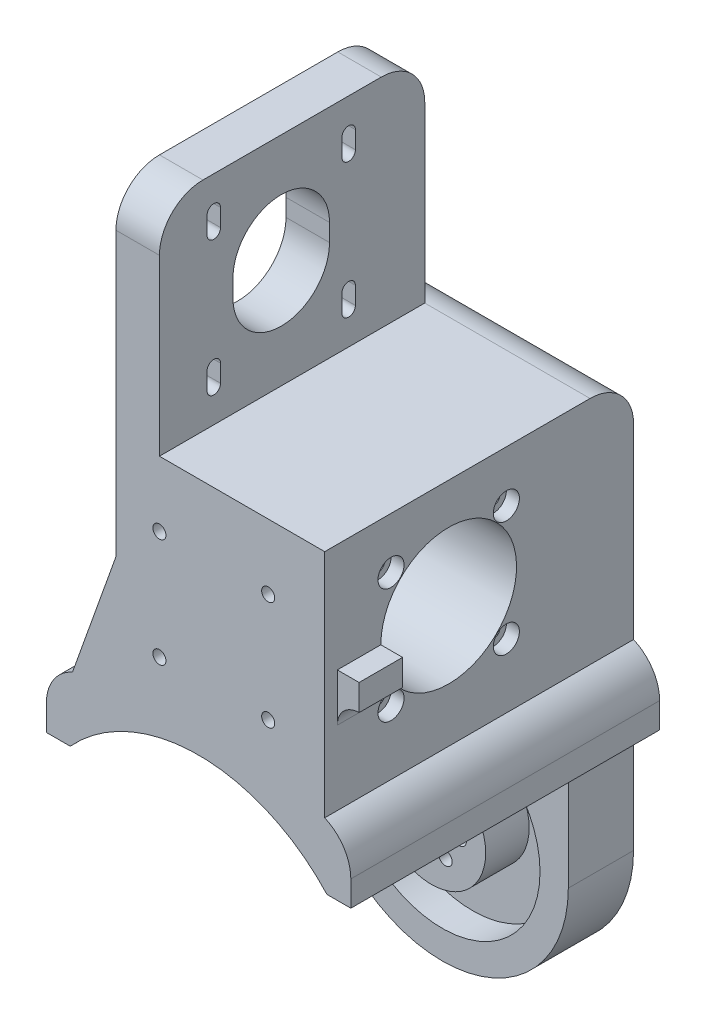
from build123d import *

# Parameters (mm, degrees)
SKETCH_1_R           = 29
EXTRUDE_1_DEPTH      = 15
SKETCH_2_R           = 1.55
SKETCH_2_R_2         = 2.6
CUT_EXTRUDE_1_DEPTH  = 44.669211122
EXTRUDE_2_DEPTH      = 71
SKETCH_12_W          = 70
SKETCH_12_H          = 15
EXTRUDE_3_DEPTH      = 71
FILLET_5_R           = 10
SKETCH_22_W          = 71
SKETCH_22_H          = 103
CUT_EXTRUDE_11_DEPTH = 10
SKETCH_4_R           = 40
CUT_EXTRUDE_2_DEPTH  = 56
SKETCH_5_R           = 15.6
SKETCH_5_R_2         = 1.55
CUT_EXTRUDE_3_DEPTH  = 171.241005636
SKETCH_6_W           = 32.2
SKETCH_6_H           = 32.2
CUT_EXTRUDE_4_DEPTH  = 23.7
CUT_EXTRUDE_5_DEPTH  = 171.241005636
SKETCH_8_W           = 10
SKETCH_8_H           = 50
CUT_EXTRUDE_6_DEPTH  = 10
FILLET_1_R           = 10
FILLET_2_R           = 10
FILLET_3_R           = 10
SKETCH_17_R          = 22.5
CUT_EXTRUDE_7_DEPTH  = 7
SKETCH_18_R          = 24
CUT_EXTRUDE_8_DEPTH  = 0.5
EXTRUDE_START        = 10
SKETCH_19_R          = 12.5
SKETCH_19_R_2        = 1.55
SKETCH_19_R_3        = 2.6
EXTRUDE_5_DEPTH      = 10
SKETCH_20_R          = 3
CUT_EXTRUDE_9_DEPTH  = 3
SKETCH_23_R          = 1.5
CUT_EXTRUDE_12_DEPTH = 161.262160225
SKETCH_27_R          = 3
CUT_EXTRUDE_14_DEPTH = 3
SKETCH_28_W          = 10
SKETCH_28_H          = 6
EXTRUDE_6_DEPTH      = 5
FILLET_6_R           = 5
EXTRUDE_7_DEPTH      = 10
EXTRUDE_8_DEPTH      = 6


# Some blends are built 0.0001 mm under size
with BuildPart() as part:
    # 草图1 → 凸台-拉伸1 (new body)
    with BuildSketch(Plane.XY):
        Circle(SKETCH_1_R)
    extrude(amount=EXTRUDE_1_DEPTH)

    # 草图2 → 切除-拉伸1 (cut, through all)
    with BuildSketch(Plane.XY.offset(15)):
        with Locations((-3.25, 5.629165125)):
            Circle(SKETCH_2_R)
        with Locations((3.25, 5.629165125)):
            Circle(SKETCH_2_R)
        with Locations((6.5, 0)):
            Circle(SKETCH_2_R)
        with Locations((3.25, -5.629165125)):
            Circle(SKETCH_2_R)
        Circle(SKETCH_2_R_2)
        with Locations((-3.25, -5.629165125)):
            Circle(SKETCH_2_R)
        with Locations((-6.5, 0)):
            Circle(SKETCH_2_R)
    extrude(amount=-CUT_EXTRUDE_1_DEPTH, mode=Mode.SUBTRACT)

    # 草图17 → 切除-拉伸7 (cut)
    with BuildSketch(Plane.XY.offset(15)):
        Circle(SKETCH_17_R)
    extrude(amount=-CUT_EXTRUDE_7_DEPTH, mode=Mode.SUBTRACT)

    # 草图18 → 切除-拉伸8 (cut)
    with BuildSketch(Plane.XY.offset(8)):
        Circle(SKETCH_18_R)
    extrude(amount=-CUT_EXTRUDE_8_DEPTH, mode=Mode.SUBTRACT)


with BuildPart() as body_2:
    # 草图3 → 凸台-拉伸2 (new body)
    with BuildSketch(Plane.XY):
        with BuildLine():
            ThreePointArc((-29, 0), (0, 29), (29, 0))
            Line((29, 0), (29, 95))
            Line((29, 95), (-9, 95))
            Line((-9, 95), (-9, 145))
            Line((-9, 145), (-29, 145))
            Line((-29, 145), (-29, 0))
        make_face()
    extrude(amount=EXTRUDE_2_DEPTH)

    # 草图12 → 凸台-拉伸3 (add)
    with BuildSketch(Plane.XY.offset(71)):
        with Locations((0, 34.5)):
            Rectangle(SKETCH_12_W, SKETCH_12_H)
    extrude(amount=-EXTRUDE_3_DEPTH)

    # 圆角5
    # the kernel refuses this fillet: 10 mm, written as the material it takes off along each edge
    with BuildSketch(Plane(origin=(35, 42, 93.912878475), x_dir=(0, -1, 0), z_dir=(0, 0, -1))) as fillet_5_piece_1:
        with BuildLine():
            CenterArc((9.16515139, 10), FILLET_5_R, 203.578178478, 66.421821522)
            Line((0, 6), (-0.183303028, 5.92))
            ThreePointArc((-0.183303028, 5.92), (-0.2, 3), (-0.2, 0))
            Line((-0.2, 0), (0, -0.2))
            Line((0, -0.2), (9.16515139, -0.2))
            Line((9.16515139, -0.2), (9.16515139, 0))
        make_face()
    extrude(amount=116.82575695, mode=Mode.SUBTRACT)
    with BuildSketch(Plane(origin=(-35, 42, 93.912878475), x_dir=(0, -1, 0), z_dir=(0, 0, -1))) as fillet_5_piece_2:
        with BuildLine():
            CenterArc((9.16515139, -10), FILLET_5_R, 90, 66.421821522)
            Line((0, -6), (-0.183303028, -5.92))
            ThreePointArc((-0.183303028, -5.92), (-0.2, -3), (-0.2, 0))
            Line((-0.2, 0), (0, 0.2))
            Line((0, 0.2), (9.16515139, 0.2))
            Line((9.16515139, 0.2), (9.16515139, 0))
        make_face()
    extrude(amount=116.82575695, mode=Mode.SUBTRACT)

    # 草图22 → 切除-拉伸11 (cut)
    with BuildSketch(Plane.ZY.offset(29)):
        with Locations((35.5, 93.5)):
            Rectangle(SKETCH_22_W, SKETCH_22_H)
    extrude(amount=-CUT_EXTRUDE_11_DEPTH, mode=Mode.SUBTRACT)

    # 草图4 → 切除-拉伸2 (cut)
    with BuildSketch(Plane.XY.offset(71)):
        Circle(SKETCH_4_R)
    extrude(amount=-CUT_EXTRUDE_2_DEPTH, mode=Mode.SUBTRACT)

    # 草图5 → 切除-拉伸3 (cut, through all)
    with BuildSketch(Plane.ZY.offset(19)):
        with Locations(Location((42.5, 70, 0), (0, 0, 270))):
            Circle(SKETCH_5_R)
        with Locations(Location((29.241747853, 83.258252147, 0), (0, 0, 270))):
            Circle(SKETCH_5_R_2)
        with Locations(Location((55.758252147, 83.258252147, 0), (0, 0, 270))):
            Circle(SKETCH_5_R_2)
        with Locations(Location((55.758252147, 56.741747853, 0), (0, 0, 270))):
            Circle(SKETCH_5_R_2)
        with Locations(Location((29.241747853, 56.741747853, 0), (0, 0, 270))):
            Circle(SKETCH_5_R_2)
    extrude(amount=-CUT_EXTRUDE_3_DEPTH, mode=Mode.SUBTRACT)

    # 草图6 → 切除-拉伸4 (cut)
    with BuildSketch(Plane.ZY.offset(19)):
        with Locations((42.5, 70)):
            Rectangle(SKETCH_6_W, SKETCH_6_H)
    extrude(amount=-CUT_EXTRUDE_4_DEPTH, mode=Mode.SUBTRACT)

    # 草图7 → 切除-拉伸5 (cut, through all)
    with BuildSketch(Plane.ZY.offset(19)):
        with BuildLine():
            Line((56.95, 137.497499937), (56.95, 133.497499937))
            ThreePointArc((56.95, 133.497499937), (58.5, 131.947499937), (60.05, 133.497499937))
            Line((60.05, 133.497499937), (60.05, 137.497499937))
            ThreePointArc((60.05, 137.497499937), (58.5, 139.047499937), (56.95, 137.497499937))
        make_face()
        with BuildLine():
            Line((54.1, 121.997499937), (54.1, 117.997499937))
            ThreePointArc((54.1, 117.997499937), (43, 106.897499937), (31.9, 117.997499937))
            Line((31.9, 117.997499937), (31.9, 121.997499937))
            ThreePointArc((31.9, 121.997499937), (43, 133.097499937), (54.1, 121.997499937))
        make_face()
        with BuildLine():
            Line((29.05, 137.497499937), (29.05, 133.497499937))
            ThreePointArc((29.05, 133.497499937), (27.5, 131.947499937), (25.95, 133.497499937))
            Line((25.95, 133.497499937), (25.95, 137.497499937))
            ThreePointArc((25.95, 137.497499937), (27.5, 139.047499937), (29.05, 137.497499937))
        make_face()
        with BuildLine():
            Line((56.95, 106.497499937), (56.95, 102.497499937))
            ThreePointArc((56.95, 102.497499937), (58.5, 100.947499937), (60.05, 102.497499937))
            Line((60.05, 102.497499937), (60.05, 106.497499937))
            ThreePointArc((60.05, 106.497499937), (58.5, 108.047499937), (56.95, 106.497499937))
        make_face()
        with BuildLine():
            Line((25.95, 106.497499937), (25.95, 102.497499937))
            ThreePointArc((25.95, 102.497499937), (27.5, 100.947499937), (29.05, 102.497499937))
            Line((29.05, 102.497499937), (29.05, 106.497499937))
            ThreePointArc((29.05, 106.497499937), (27.5, 108.047499937), (25.95, 106.497499937))
        make_face()
    extrude(amount=-CUT_EXTRUDE_5_DEPTH, mode=Mode.SUBTRACT)

    # 草图8 → 切除-拉伸6 (cut)
    with BuildSketch(Plane(origin=(0, 0, 0), x_dir=(-1, 0, 0), z_dir=(0, 0, -1))):
        with Locations((14, 120)):
            Rectangle(SKETCH_8_W, SKETCH_8_H)
    extrude(amount=-CUT_EXTRUDE_6_DEPTH, mode=Mode.SUBTRACT)

    # 圆角1
    fillet_1_edges = [body_2.edges().sort_by_distance(p)[0] for p in [
        (5, 95, 0),
    ]]
    fillet(fillet_1_edges, radius=FILLET_1_R)

    # 圆角2
    fillet_2_edges = [body_2.edges().sort_by_distance(p)[0] for p in [
        (-14, 145, 10),
    ]]
    fillet(fillet_2_edges, radius=FILLET_2_R)

    # 圆角3
    fillet_3_edges = [body_2.edges().sort_by_distance(p)[0] for p in [
        (-14, 145, 71),
    ]]
    fillet(fillet_3_edges, radius=FILLET_3_R)


    add(part.part)  # 凸台-拉伸5 merges part
    # 草图19 → 凸台-拉伸5 (add)
    with BuildSketch(Plane.XY.offset(7.5).offset(EXTRUDE_START)):
        Circle(SKETCH_19_R)
        with Locations((-3.25, -5.629165125)):
            Circle(SKETCH_19_R_2, mode=Mode.SUBTRACT)
        with Locations((3.25, -5.629165125)):
            Circle(SKETCH_19_R_2, mode=Mode.SUBTRACT)
        with Locations((6.5, 0)):
            Circle(SKETCH_19_R_2, mode=Mode.SUBTRACT)
        Circle(SKETCH_19_R_3, mode=Mode.SUBTRACT)
        with Locations((3.25, 5.629165125)):
            Circle(SKETCH_19_R_2, mode=Mode.SUBTRACT)
        with Locations((-3.25, 5.629165125)):
            Circle(SKETCH_19_R_2, mode=Mode.SUBTRACT)
        with Locations((-6.5, 0)):
            Circle(SKETCH_19_R_2, mode=Mode.SUBTRACT)
    extrude(amount=-EXTRUDE_5_DEPTH)

    # 草图20 → 切除-拉伸9 (cut)
    with BuildSketch(Plane(origin=(0, 0, 0), x_dir=(-1, 0, 0), z_dir=(0, 0, -1))):
        with Locations((-3.25, 5.629165125)):
            Circle(SKETCH_20_R)
        with Locations((3.25, 5.629165125)):
            Circle(SKETCH_20_R)
        with Locations((-6.5, 0)):
            Circle(SKETCH_20_R)
        with Locations((-3.25, -5.629165125)):
            Circle(SKETCH_20_R)
        with Locations((3.25, -5.629165125)):
            Circle(SKETCH_20_R)
        with Locations((6.5, 0)):
            Circle(SKETCH_20_R)
    extrude(amount=-CUT_EXTRUDE_9_DEPTH, mode=Mode.SUBTRACT)

    # 草图23 → 切除-拉伸12 (cut, through all)
    with BuildSketch(Plane(origin=(0, 0, 58.6), x_dir=(-1, 0, 0), z_dir=(0, 0, -1))):
        with Locations((-16, 80)):
            Circle(SKETCH_23_R)
        with Locations((9, 80)):
            Circle(SKETCH_23_R)
        with Locations((9, 55)):
            Circle(SKETCH_23_R)
        with Locations((-16, 55)):
            Circle(SKETCH_23_R)
    extrude(amount=-CUT_EXTRUDE_12_DEPTH, mode=Mode.SUBTRACT)

    # 草图27 → 切除-拉伸14 (cut)
    with BuildSketch(Plane(origin=(29, 0, 0), x_dir=(0, 0, -1), z_dir=(1, 0, 0))):
        with Locations((-55.758252147, 83.258252147)):
            Circle(SKETCH_27_R)
        with Locations((-29.241747853, 83.258252147)):
            Circle(SKETCH_27_R)
        with Locations((-55.758252147, 56.741747853)):
            Circle(SKETCH_27_R)
        with Locations((-29.241747853, 56.741747853)):
            Circle(SKETCH_27_R)
    extrude(amount=-CUT_EXTRUDE_14_DEPTH, mode=Mode.SUBTRACT)

    # 草图28 → 凸台-拉伸6 (add)
    with BuildSketch(Plane(origin=(29, 0, 0), x_dir=(0, 0, -1), z_dir=(1, 0, 0))):
        with Locations((-63.1, 67)):
            Rectangle(SKETCH_28_W, SKETCH_28_H)
    extrude(amount=EXTRUDE_6_DEPTH)

    # 圆角6
    fillet_6_edges = [body_2.edges().sort_by_distance(p)[0] for p in [
        (29, 64, 63.1),
    ]]
    fillet(fillet_6_edges, radius=FILLET_6_R - 0.0001)  # a hair under: the kernel refuses the full size

    # 草图29 → 凸台-拉伸7 (add)
    with BuildSketch(Plane(origin=(0, 0, 0), x_dir=(-1, 0, 0), z_dir=(0, 0, -1))):
        Polygon((19, 70), (29, 42), (19, 42), align=None)
    extrude(amount=-EXTRUDE_7_DEPTH)

    # 草图30 → 凸台-拉伸8 (add)
    with BuildSketch(Plane.XY.offset(71)):
        Polygon((-29, 42), (-19, 70), (-19, 42), align=None)
    extrude(amount=-EXTRUDE_8_DEPTH)


solid = body_2.part
